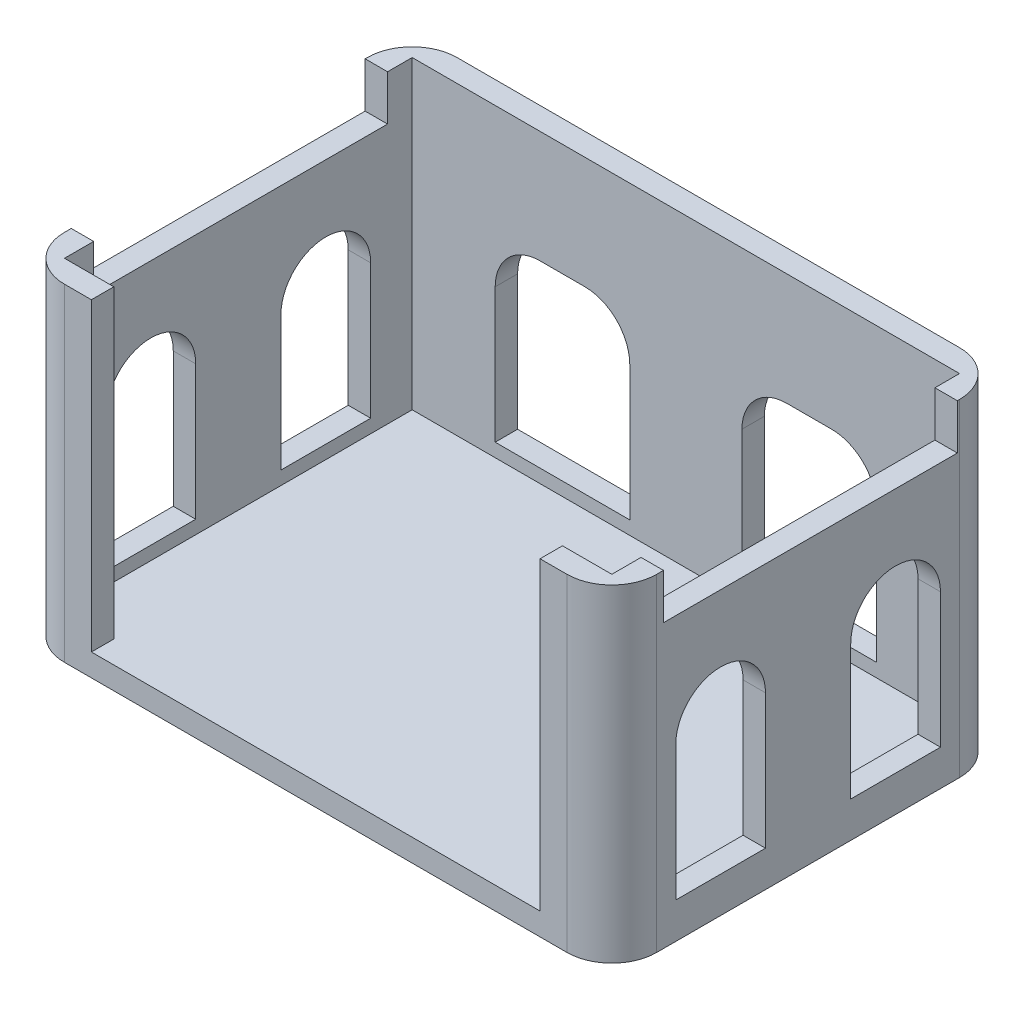
from build123d import *

# Parameters (mm, degrees)
SKETCH1_W               = 132
SKETCH1_H               = 87.5
BOSS_EXTRUDE1_DEPTH     = 5
BOSS_EXTRUDE2_DEPTH     = 68
CUT_EXTRUDE1_DEPTH      = 175.382481918
CUT_EXTRUDE1_DEPTH_BACK = 175.382481918
SKETCH3_W               = 20
SKETCH3_H               = 40
CUT_EXTRUDE2_REACH      = 176.382
SKETCH4_W               = 30
SKETCH4_H               = 40
SKETCH5_W               = 65.5
SKETCH5_H               = 10.1
CUT_EXTRUDE3_DEPTH      = 175.382481918
FILLET1_R               = 10


with BuildPart() as part:
    # Sketch1 → Boss-Extrude1 (new body)
    with BuildSketch(Plane(origin=(0, 0, 0), x_dir=(1, 0, 0), z_dir=(0, 1, 0))):
        with Locations((66, 43.75)):
            Rectangle(SKETCH1_W, SKETCH1_H)
    extrude(amount=BOSS_EXTRUDE1_DEPTH)

    # Sketch2 → Boss-Extrude2 (add)
    with BuildSketch(Plane(origin=(0, 5, 0), x_dir=(1, 0, 0), z_dir=(0, 1, 0))):
        Polygon((5, 5), (16, 5), (16, 0), (0, 0), (0, 87.5), (132, 87.5), (132, 0), (116, 0), (116, 5), (127, 5), (127, 82.5), (5, 82.5), align=None)
    extrude(amount=BOSS_EXTRUDE2_DEPTH)

    # Sketch3 → Cut-Extrude1 (cut, two sides: drawn at the far end of the back side and taken through both)
    with BuildSketch(Plane(origin=(132, 0, 0), x_dir=(0, 0, -1), z_dir=(1, 0, 0)).offset(-CUT_EXTRUDE1_DEPTH_BACK)):
        with Locations((24.25, 28)):
            Rectangle(SKETCH3_W, SKETCH3_H)
        with Locations((63.25, 28)):
            Rectangle(SKETCH3_W, SKETCH3_H)
    extrude(amount=CUT_EXTRUDE1_DEPTH + CUT_EXTRUDE1_DEPTH_BACK, mode=Mode.SUBTRACT)

    # Sketch4 → Cut-Extrude2 (cut, up to next)
    with BuildSketch(Plane(origin=(0, 0, -87.5), x_dir=(-1, 0, 0), z_dir=(0, 0, -1)), mode=Mode.PRIVATE) as cut_extrude2_sk1:
        with Locations((-93.5, 28)):
            Rectangle(SKETCH4_W, SKETCH4_H)
    cut_extrude2_tool1 = extrude(cut_extrude2_sk1.sketch, amount=-CUT_EXTRUDE2_REACH, mode=Mode.PRIVATE) & part.part
    # Sketch4 → Cut-Extrude2 (cut, up to next)
    with BuildSketch(Plane(origin=(0, 0, -87.5), x_dir=(-1, 0, 0), z_dir=(0, 0, -1)), mode=Mode.PRIVATE) as cut_extrude2_sk2:
        with Locations((-38.5, 28)):
            Rectangle(SKETCH4_W, SKETCH4_H)
    cut_extrude2_tool2 = extrude(cut_extrude2_sk2.sketch, amount=-CUT_EXTRUDE2_REACH, mode=Mode.PRIVATE) & part.part
    add(cut_extrude2_tool1.solids().sort_by_distance((93.5, 28, -87.5))[0], mode=Mode.SUBTRACT)
    add(cut_extrude2_tool2.solids().sort_by_distance((38.5, 28, -87.5))[0], mode=Mode.SUBTRACT)

    # Sketch5 → Cut-Extrude3 (cut, through all)
    with BuildSketch(Plane.ZY):
        with Locations((-44.2623336, 67.95)):
            Rectangle(SKETCH5_W, SKETCH5_H)
    extrude(amount=-CUT_EXTRUDE3_DEPTH, mode=Mode.SUBTRACT)

    # Fillet1
    fillet1_edges = [part.edges().sort_by_distance(p)[0] for p in [
        (108.5, 48, -85),
        (78.5, 48, -85),
        (53.5, 48, -85),
        (23.5, 48, -85),
        (2.5, 48, -73.25),
        (2.5, 48, -53.25),
        (2.5, 48, -14.25),
        (2.5, 48, -34.25),
        (129.5, 48, -14.25),
        (129.5, 48, -34.25),
        (129.5, 48, -73.25),
        (129.5, 48, -53.25),
        (132, 36.5, -87.5),
        (132, 36.5, 0),
        (0, 36.5, 0),
        (0, 36.5, -87.5),
    ]]
    fillet(fillet1_edges, radius=FILLET1_R - 0.0001)  # a hair under: the kernel refuses the full size


solid = part.part
